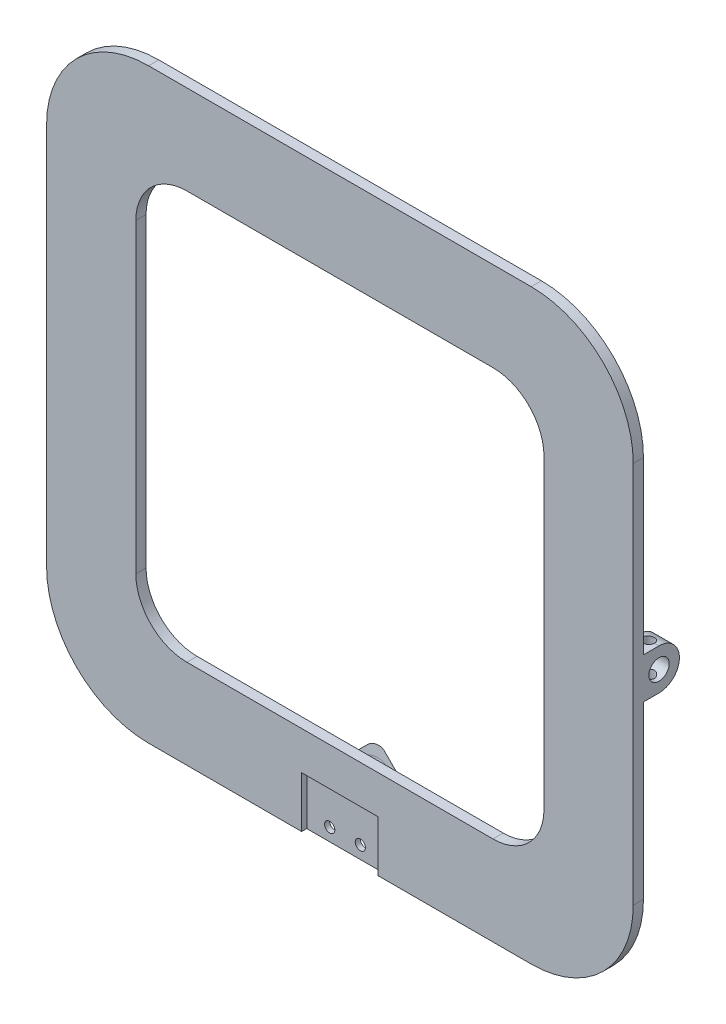
from build123d import *

# Parameters (mm, degrees)
SZKIC1_W                         = 115
SZKIC1_H                         = 115
DODANIE_WYCI_GNI_CIE1_DEPTH      = 2
DODANIE_WYCI_GNI_CIE2_DEPTH      = 4
SZKIC5_R                         = 2
WYTNIJ_WYCI_GNI_CIE1_DEPTH       = 163.787318778
SZKIC6_R                         = 1
WYTNIJ_WYCI_GNI_CIE2_DEPTH       = 10
ZAOKR_GLENIE1_R                  = 20
SZKIC7_W                         = 15
SZKIC7_H                         = 10
WYTNIJ_WYCI_GNI_CIE3_DEPTH       = 1
WYTNIJ_WYCI_GNI_CIE4_DEPTH       = 10
SZKIC9_R                         = 1.1
WYTNIJ_WYCI_GNI_CIE5_DEPTH       = 131.602301492
SZKIC10_R                        = 1.1
WYTNIJ_WYCI_GNI_CIE6_DEPTH       = 10
DODANIE_WYCI_GNI_CIE4_DEPTH      = 8
SZKIC14_W                        = 6
SZKIC14_H                        = 6
WYTNIJ_WYCI_GNI_CIE8_DEPTH       = 8
ZAOKR_GLENIE3_R                  = 2
ZAOKR_GLENIE4_R                  = 1
DODANIE_WYCI_GNI_CIE5_DEPTH      = 8
SZKIC16_W                        = 6
SZKIC16_H                        = 6
WYTNIJ_WYCI_GNI_CIE9_DEPTH       = 8
ZAOKR_GLENIE5_R                  = 2
ZAOKR_GLENIE6_R                  = 1
SZYK_LINIOWY1_COUNT              = 2
SZYK_LINIOWY1_PITCH              = 45
ZAOKR_GLENIE5_OF_SZYK_LINIOWY1_R = 2
ZAOKR_GLENIE6_OF_SZYK_LINIOWY1_R = 1


with BuildPart() as part:
    # Szkic1 → Dodanie-wyciągnięcie1 (new body)
    with BuildSketch(Plane.XY):
        with Locations((57.5, -57.5)):
            Rectangle(SZKIC1_W, SZKIC1_H)
    extrude(amount=DODANIE_WYCI_GNI_CIE1_DEPTH)

    # Szkic3 → Dodanie-wyciągnięcie2 (add)
    with BuildSketch(Plane(origin=(115, 0, 0), x_dir=(0, 0, -1), z_dir=(1, 0, 0))):
        with BuildLine():
            Line((0, -53.5), (3.050613798, -53.5))
            ThreePointArc((3.050613798, -53.5), (7.050613798, -57.5), (3.050613798, -61.5))
            Line((3.050613798, -61.5), (0, -61.5))
            Line((0, -61.5), (0, -53.5))
        make_face()
    dodanie_wyci_gni_cie2 = extrude(amount=-DODANIE_WYCI_GNI_CIE2_DEPTH)

    # Lustro1: Dodanie-wyciągnięcie2 across plane
    add(dodanie_wyci_gni_cie2.mirror(Plane(origin=(57.5, 0, 0), x_dir=(0, 0, 1), z_dir=(1, 0, 0))))

    # Szkic5 → Wytnij-wyciągnięcie1 (cut, through all)
    with BuildSketch(Plane(origin=(115, 0, 0), x_dir=(0, 0, -1), z_dir=(1, 0, 0))):
        with Locations((3.050613798, -57.5)):
            Circle(SZKIC5_R)
    extrude(amount=-WYTNIJ_WYCI_GNI_CIE1_DEPTH, mode=Mode.SUBTRACT)

    # Szkic6 → Wytnij-wyciągnięcie2 (cut)
    with BuildSketch(Plane.XY.offset(2)):
        with Locations((54.5, -112.5)):
            Circle(SZKIC6_R)
        with Locations((60.5, -112.5)):
            Circle(SZKIC6_R)
    extrude(amount=-WYTNIJ_WYCI_GNI_CIE2_DEPTH, mode=Mode.SUBTRACT)

    # Zaokrąglenie1
    zaokr_glenie1_edges = [part.edges().sort_by_distance(p)[0] for p in [
        (0, -115, 1),
        (115, -115, 1),
        (0, 0, 1),
        (115, 0, 1),
    ]]
    fillet(zaokr_glenie1_edges, radius=ZAOKR_GLENIE1_R)

    # Szkic7 → Wytnij-wyciągnięcie3 (cut)
    with BuildSketch(Plane.XY.offset(2)):
        with Locations((57.5, -110)):
            Rectangle(SZKIC7_W, SZKIC7_H)
    extrude(amount=-WYTNIJ_WYCI_GNI_CIE3_DEPTH, mode=Mode.SUBTRACT)

    # Szkic8 → Wytnij-wyciągnięcie4 (cut)
    with BuildSketch(Plane(origin=(0, 0, 0), x_dir=(-1, 0, 0), z_dir=(0, 0, -1))):
        with BuildLine():
            Line((-87.5, -97.5), (-27.5, -97.5))
            ThreePointArc((-27.5, -97.5), (-20.428932188, -94.571067812), (-17.5, -87.5))
            Line((-17.5, -87.5), (-17.5, -27.5))
            ThreePointArc((-17.5, -27.5), (-20.428932188, -20.428932188), (-27.5, -17.5))
            Line((-27.5, -17.5), (-87.5, -17.5))
            ThreePointArc((-87.5, -17.5), (-94.571067812, -20.428932188), (-97.5, -27.5))
            Line((-97.5, -27.5), (-97.5, -87.5))
            ThreePointArc((-97.5, -87.5), (-94.571067812, -94.571067812), (-87.5, -97.5))
        make_face()
    extrude(amount=-WYTNIJ_WYCI_GNI_CIE4_DEPTH, mode=Mode.SUBTRACT)

    # Szkic9 → Wytnij-wyciągnięcie5 (cut, through all)
    with BuildSketch(Plane(origin=(0, -53.5, 0), x_dir=(1, 0, 0), z_dir=(0, 1, 0))):
        with Locations((2, 3.050613798)):
            Circle(SZKIC9_R)
    extrude(amount=-WYTNIJ_WYCI_GNI_CIE5_DEPTH, mode=Mode.SUBTRACT)

    # Szkic10 → Wytnij-wyciągnięcie6 (cut)
    with BuildSketch(Plane(origin=(0, -53.5, 0), x_dir=(1, 0, 0), z_dir=(0, 1, 0))):
        with Locations((113, 3.050613798)):
            Circle(SZKIC10_R)
    extrude(amount=-WYTNIJ_WYCI_GNI_CIE6_DEPTH, mode=Mode.SUBTRACT)

    # Szkic13 → Dodanie-wyciągnięcie4 (add)
    with BuildSketch(Plane(origin=(0, 0, 0), x_dir=(-1, 0, 0), z_dir=(0, 0, -1))):
        Polygon((-53.080582618, -103.598349571), (-60.151650429, -110.669417382), (-61.919417382, -108.901650429), (-54.848349571, -101.830582618), align=None)
    extrude(amount=DODANIE_WYCI_GNI_CIE4_DEPTH)

    # Szkic14 → Wytnij-wyciągnięcie8 (cut)
    with BuildSketch(Plane(origin=(-25.258883476, -25.258883476, 0), x_dir=(-0.7071067811865481, 0.707106781186547, 0), z_dir=(-0.707106781186547, -0.7071067811865481, 0))):
        with Locations((-115.788735419, 3)):
            Rectangle(SZKIC14_W, SZKIC14_H)
    extrude(amount=-WYTNIJ_WYCI_GNI_CIE8_DEPTH, mode=Mode.SUBTRACT)

    # Zaokrąglenie3
    zaokr_glenie3_edges = [part.edges().sort_by_distance(p)[0] for p in [
        (59.621320344, -108.371320344, -6),
        (55.378679656, -104.128679656, -6),
        (61.035533906, -109.785533906, -8),
        (53.964466094, -102.714466094, -8),
    ]]
    fillet(zaokr_glenie3_edges, radius=ZAOKR_GLENIE3_R)

    # Zaokrąglenie4
    zaokr_glenie4_edges = [part.edges().sort_by_distance(p)[0] for p in [
        (56.262563133, -103.24479618, -2),
        (56.676776695, -103.659009742, -5.414213562),
        (58.383883476, -105.366116524, -6),
        (60.090990258, -107.073223305, -5.414213562),
        (54.49479618, -105.012563133, -2),
        (54.909009742, -105.426776695, -5.414213562),
        (56.616116524, -107.133883476, -6),
        (58.323223305, -108.840990258, -5.414213562),
        (60.50520382, -107.487436867, -2),
        (58.737436867, -109.25520382, -2),
    ]]
    fillet(zaokr_glenie4_edges, radius=ZAOKR_GLENIE4_R)

    # Szkic15 → Dodanie-wyciągnięcie5 (add)
    with BuildSketch(Plane(origin=(0, 0, 0), x_dir=(-1, 0, 0), z_dir=(0, 0, -1))):
        Polygon((-104.697591975, -106.465358928), (-106.465358928, -104.697591975), (-99.394291117, -97.626524164), (-97.626524164, -99.394291117), align=None)
    dodanie_wyci_gni_cie5 = extrude(amount=DODANIE_WYCI_GNI_CIE5_DEPTH)

    # Szkic16 → Wytnij-wyciągnięcie9 (cut)
    with BuildSketch(Plane(origin=(-0.883883476, -0.883883476, 0), x_dir=(-0.7071067811865475, 0.7071067811865477, 0), z_dir=(-0.7071067811865477, -0.7071067811865475, 0))):
        with Locations((-144.31475452, 3)):
            Rectangle(SZKIC16_W, SZKIC16_H)
    wytnij_wyci_gni_cie9 = extrude(amount=-WYTNIJ_WYCI_GNI_CIE9_DEPTH, mode=Mode.SUBTRACT)

    # Zaokrąglenie5
    zaokr_glenie5_edges = [part.edges().sort_by_distance(p)[0] for p in [
        (99.924621202, -99.924621202, -6),
        (104.16726189, -104.16726189, -6),
        (98.51040764, -98.51040764, -8),
        (105.581475452, -105.581475452, -8),
    ]]
    fillet(zaokr_glenie5_edges, radius=ZAOKR_GLENIE5_R)

    # Zaokrąglenie6
    zaokr_glenie6_edges = [part.edges().sort_by_distance(p)[0] for p in [
        (100.808504679, -99.040737726, -2),
        (101.222718241, -99.454951288, -5.414213562),
        (102.929825023, -101.16205807, -6),
        (105.051145366, -103.283378413, -2),
        (99.040737726, -100.808504679, -2),
        (99.454951288, -101.222718241, -5.414213562),
        (101.16205807, -102.929825023, -6),
        (102.869164851, -104.636931804, -5.414213562),
        (104.636931804, -102.869164851, -5.414213562),
        (103.283378413, -105.051145366, -2),
    ]]
    fillet(zaokr_glenie6_edges, radius=ZAOKR_GLENIE6_R)

    # Szyk liniowy1: Dodanie-wyciągnięcie5, Wytnij-wyciągnięcie9 ×2
    with Locations(*[(0, i * SZYK_LINIOWY1_PITCH, 0) for i in range(1, SZYK_LINIOWY1_COUNT)]):
        add(dodanie_wyci_gni_cie5)
        add(wytnij_wyci_gni_cie9, mode=Mode.SUBTRACT)

    # Zaokrąglenie5 of Szyk liniowy1
    zaokr_glenie5_of_szyk_liniowy1_edges = [part.edges().sort_by_distance(p)[0] for p in [
        (99.924621202, -54.924621202, -6),
        (104.16726189, -59.16726189, -6),
        (98.51040764, -53.51040764, -8),
        (105.581475452, -60.581475452, -8),
    ]]
    fillet(zaokr_glenie5_of_szyk_liniowy1_edges, radius=ZAOKR_GLENIE5_OF_SZYK_LINIOWY1_R)

    # Zaokrąglenie6 of Szyk liniowy1
    zaokr_glenie6_of_szyk_liniowy1_edges = [part.edges().sort_by_distance(p)[0] for p in [
        (100.808504679, -54.040737726, -2),
        (101.222718241, -54.454951288, -5.414213562),
        (102.929825023, -56.16205807, -6),
        (105.051145366, -58.283378413, -2),
        (99.040737726, -55.808504679, -2),
        (99.454951288, -56.222718241, -5.414213562),
        (101.16205807, -57.929825023, -6),
        (102.869164851, -59.636931804, -5.414213562),
        (104.636931804, -57.869164851, -5.414213562),
        (103.283378413, -60.051145366, -2),
    ]]
    fillet(zaokr_glenie6_of_szyk_liniowy1_edges, radius=ZAOKR_GLENIE6_OF_SZYK_LINIOWY1_R)


solid = part.part
